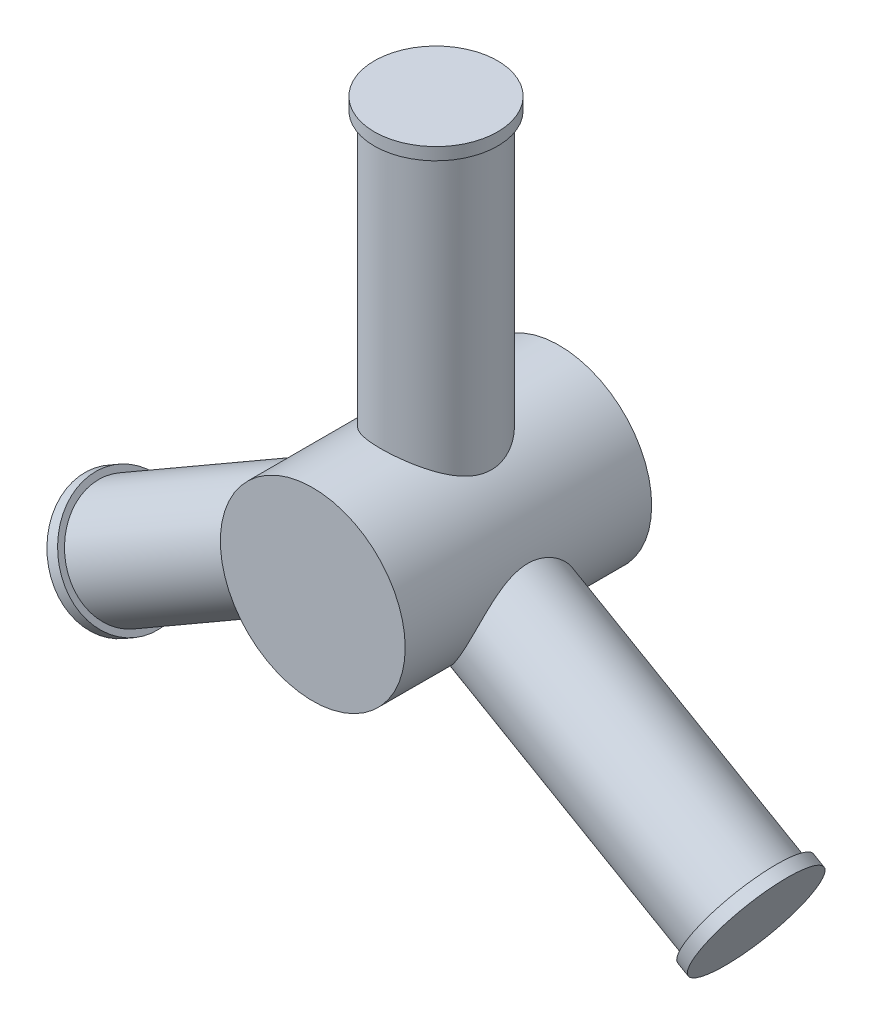
from build123d import *

# Parameters (mm, degrees)
AUFSATZ_LINEAR_AUSTRAGEN1_DEPTH      = 1000
AUFSATZ_LINEAR_AUSTRAGEN1_DEPTH_BACK = 1000
SKIZZE1_R                            = 750
SKIZZE2_R                            = 450
AUFSATZ_LINEAR_AUSTRAGEN2_DEPTH      = 3000
AUFSATZ_LINEAR_START                 = 2900
SKIZZE3_R                            = 500
AUFSATZ_LINEAR_AUSTRAGEN3_DEPTH      = 100
KREISMUSTER1_COUNT                   = 3
KREISMUSTER2_COUNT                   = 3


with BuildPart() as part:
    # Skizze1 → Aufsatz-Linear austragen1 (new, two sides: drawn at the far end of the back side and taken through both)
    with BuildSketch(Plane.XY.offset(-AUFSATZ_LINEAR_AUSTRAGEN1_DEPTH_BACK)):
        Circle(SKIZZE1_R)
    extrude(amount=AUFSATZ_LINEAR_AUSTRAGEN1_DEPTH + AUFSATZ_LINEAR_AUSTRAGEN1_DEPTH_BACK)

    # Skizze2 → Aufsatz-Linear austragen2 (add)
    with BuildSketch(Plane(origin=(0, 0, 0), x_dir=(1, 0, 0), z_dir=(0, 1, 0))):
        Circle(SKIZZE2_R)
    aufsatz_linear_austragen2 = extrude(amount=AUFSATZ_LINEAR_AUSTRAGEN2_DEPTH)

    # Skizze3 → Aufsatz-Linear austragen3 (add)
    with BuildSketch(Plane(origin=(0, 0, 0), x_dir=(1, 0, 0), z_dir=(0, 1, 0)).offset(AUFSATZ_LINEAR_START)):
        Circle(SKIZZE3_R)
    aufsatz_linear_austragen3 = extrude(amount=AUFSATZ_LINEAR_AUSTRAGEN3_DEPTH)

    # Kreismuster1: Aufsatz-Linear austragen2 ×3 about axis
    kreismuster1_axis = Axis((0, 0, -1000), (0, 0, -1))
    for i in range(1, KREISMUSTER1_COUNT):
        add(aufsatz_linear_austragen2.rotate(kreismuster1_axis, i * 360 / KREISMUSTER1_COUNT))

    # Kreismuster2: Aufsatz-Linear austragen3 ×3 about axis
    kreismuster2_axis = Axis((0, 0, -1000), (0, 0, -1))
    for i in range(1, KREISMUSTER2_COUNT):
        add(aufsatz_linear_austragen3.rotate(kreismuster2_axis, i * 360 / KREISMUSTER2_COUNT))


solid = part.part
